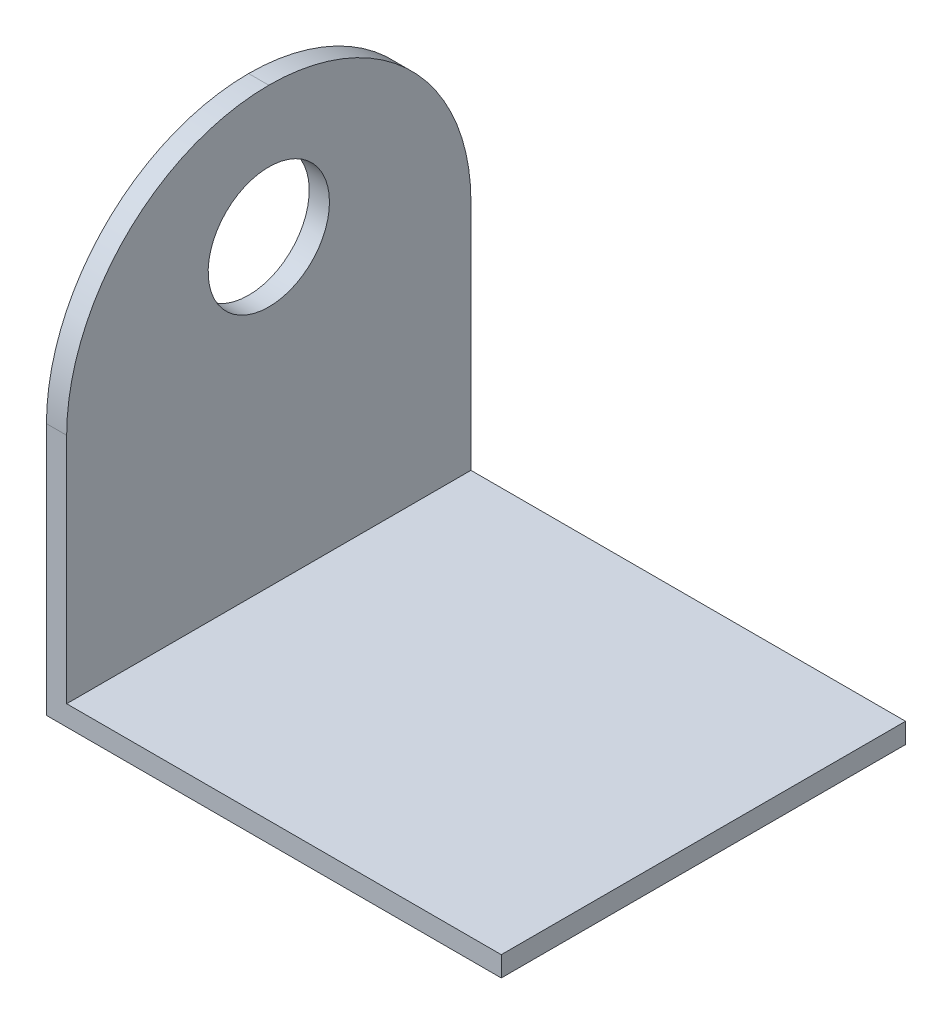
from build123d import *

# Parameters (mm, degrees)
BOSS_EXTRUDE1_DEPTH = 40
FILLET1_R           = 20
FILLET2_R           = 20
SKETCH2_R           = 6
CUT_EXTRUDE1_DEPTH  = 10


with BuildPart() as part:
    # Sketch1 → Boss-Extrude1 (new body)
    with BuildSketch(Plane.XY):
        Polygon((0, 0), (0, -45), (45, -45), (45, -43), (2, -43), (2, 0), align=None)
    extrude(amount=-BOSS_EXTRUDE1_DEPTH)

    # Fillet1
    fillet1_edges = [part.edges().sort_by_distance(p)[0] for p in [
        (1, 0, -40),
    ]]
    fillet(fillet1_edges, radius=FILLET1_R)

    # Fillet2
    fillet2_edges = [part.edges().sort_by_distance(p)[0] for p in [
        (1, 0, 0),
    ]]
    fillet(fillet2_edges, radius=FILLET2_R - 0.0001)  # a hair under: the kernel refuses the full size

    # Sketch2 → Cut-Extrude1 (cut)
    with BuildSketch(Plane.ZY):
        with Locations(Location((-20, -13.002174514, 0), (0, 0, 270))):
            Circle(SKETCH2_R)
    extrude(amount=-CUT_EXTRUDE1_DEPTH, mode=Mode.SUBTRACT)


solid = part.part
